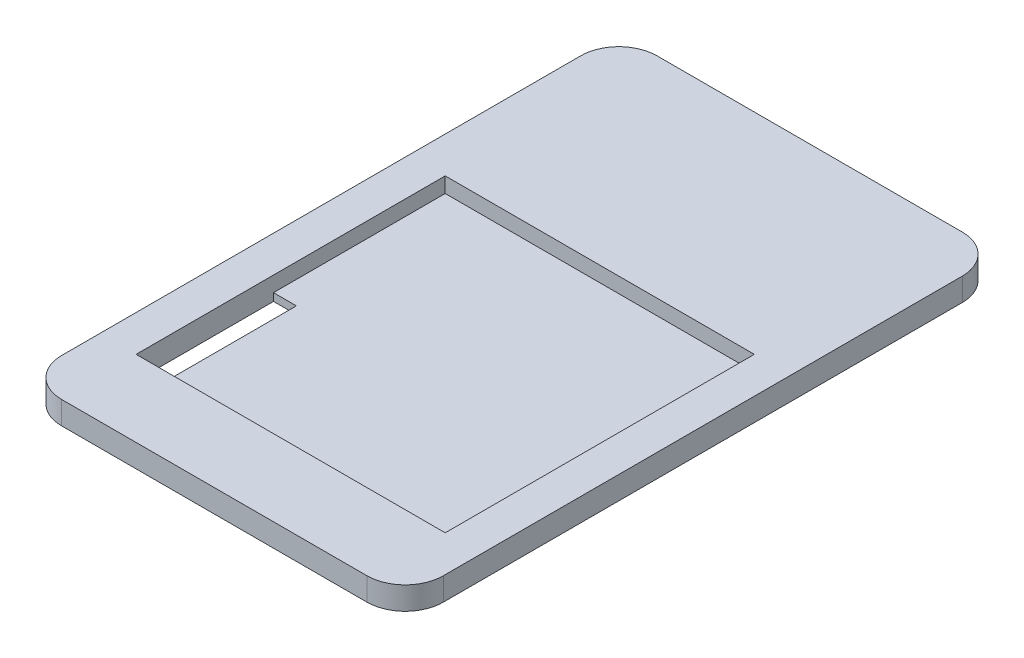
from build123d import *

# Parameters (mm, degrees)
SKETCH1_W           = 50
SKETCH1_H           = 78
BOSS_EXTRUDE1_DEPTH = 3
BOSS_EXTRUDE2_DEPTH = 1
FILLET1_R           = 5


with BuildPart() as part:
    # Sketch1 → Boss-Extrude1 (new body)
    with BuildSketch(Plane(origin=(0, 0, 0), x_dir=(1, 0, 0), z_dir=(0, 1, 0))):
        Rectangle(SKETCH1_W, SKETCH1_H)
        Polygon((-20.25, -27), (-20.25, -11), (-20.25, 11.5), (20.25, 11.5), (20.25, -29), (-20.25, -29), align=None, mode=Mode.SUBTRACT)
    extrude(amount=BOSS_EXTRUDE1_DEPTH)

    # Sketch1<3> → Boss-Extrude2 (add)
    with BuildSketch(Plane(origin=(0, 0, 0), x_dir=(1, 0, 0), z_dir=(0, 1, 0))):
        Polygon((-20.25, 11.5), (-20.25, -11), (-17.25, -11), (-17.25, -27), (-20.25, -27), (-20.25, -29), (20.25, -29), (20.25, 11.5), align=None)
    extrude(amount=BOSS_EXTRUDE2_DEPTH)

    # Fillet1
    fillet1_edges = [part.edges().sort_by_distance(p)[0] for p in [
        (-25, 1.5, 39),
        (25, 1.5, 39),
        (25, 1.5, -39),
        (-25, 1.5, -39),
    ]]
    fillet(fillet1_edges, radius=FILLET1_R)


solid = part.part
